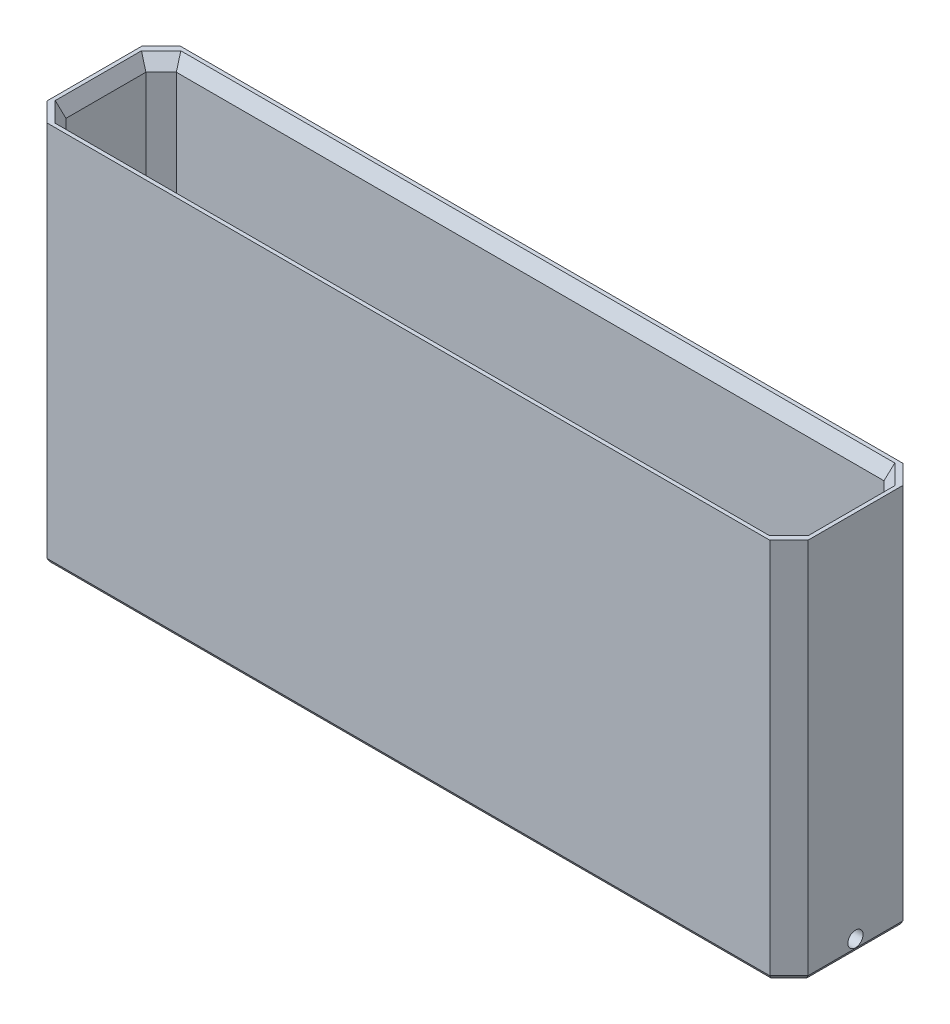
from build123d import *

# Parameters (mm, degrees)
SKETCH1_W           = 194
SKETCH1_H           = 29
BOSS_EXTRUDE1_DEPTH = 100
SKETCH1_3_W         = 194
SKETCH1_3_H         = 29
BOSS_EXTRUDE2_DEPTH = 3
CHAMFER1_SIZE       = 4
CHAMFER2_SIZE       = 5
CHAMFER3_SIZE       = 2
CHAMFER3_SIZE2      = 3.464101615
SKETCH2_R           = 2
CUT_EXTRUDE1_DEPTH  = 10
CHAMFER4_SIZE       = 0.5
CHAMFER4_SIZE2      = 0.866025404


with BuildPart() as part:
    # Sketch1 → Boss-Extrude1 (new body)
    with BuildSketch(Plane(origin=(0, 0, 0), x_dir=(1, 0, 0), z_dir=(0, 1, 0))):
        Polygon((-100, -17.5), (100, -17.5), (100, 17.5), (-97, 17.5), (-100, 17.5), (-100, 14.5), align=None)
        Rectangle(SKETCH1_W, SKETCH1_H, mode=Mode.SUBTRACT)
    extrude(amount=BOSS_EXTRUDE1_DEPTH)

    # Sketch1<3> → Boss-Extrude2 (add)
    with BuildSketch(Plane(origin=(0, 0, 0), x_dir=(1, 0, 0), z_dir=(0, 1, 0))):
        Rectangle(SKETCH1_3_W, SKETCH1_3_H)
    extrude(amount=BOSS_EXTRUDE2_DEPTH)

    # Chamfer1
    chamfer1_edges = [part.edges().sort_by_distance(p)[0] for p in [
        (0, 3, -14.5),
        (97, 51.5, -14.5),
        (97, 3, 0),
        (97, 51.5, 14.5),
        (0, 3, 14.5),
        (-97, 51.5, 14.5),
        (-97, 3, 0),
        (-97, 51.5, -14.5),
    ]]
    chamfer(chamfer1_edges, length=CHAMFER1_SIZE)

    # Chamfer2
    chamfer2_edges = [part.edges().sort_by_distance(p)[0] for p in [
        (100, 50, -17.5),
        (100, 50, 17.5),
        (-100, 50, 17.5),
        (-100, 50, -17.5),
    ]]
    chamfer(chamfer2_edges, length=CHAMFER2_SIZE)

    # Chamfer3
    chamfer3_edges = [part.edges().sort_by_distance(p)[0] for p in [
        (95, 100, 12.5),
        (97, 100, 0),
        (95, 100, -12.5),
        (0, 100, 14.5),
        (-95, 100, 12.5),
        (-97, 100, 0),
        (-95, 100, -12.5),
        (0, 100, -14.5),
    ]]
    chamfer3_side = [part.faces().sort_by_distance(p)[0] for p in [
        (0, 100, 15.46960595),
    ]]
    chamfer(chamfer3_edges, length=CHAMFER3_SIZE, length2=CHAMFER3_SIZE2, reference=chamfer3_side[0])

    # Sketch2 → Cut-Extrude1 (cut)
    with BuildSketch(Plane(origin=(100, 0, 0), x_dir=(0, 0, -1), z_dir=(1, 0, 0))):
        with Locations((0, 3)):
            Circle(SKETCH2_R)
    cut_extrude1 = extrude(amount=-CUT_EXTRUDE1_DEPTH, mode=Mode.SUBTRACT)

    # Mirror1: Cut-Extrude1 across plane
    add(cut_extrude1.mirror(Plane(origin=(0, 0, 0), x_dir=(0, 0, 1), z_dir=(1, 0, 0))), mode=Mode.SUBTRACT)

    # Chamfer4
    chamfer4_edges = [part.edges().sort_by_distance(p)[0] for p in [
        (-97.5, 0, -15),
        (-100, 0, 0),
        (-97.5, 0, 15),
        (0, 0, 17.5),
        (97.5, 0, 15),
        (100, 0, 0),
        (97.5, 0, -15),
        (0, 0, -17.5),
    ]]
    chamfer4_side = [part.faces().sort_by_distance(p)[0] for p in [
        (0, 0, 0),
    ]]
    chamfer(chamfer4_edges, length=CHAMFER4_SIZE, length2=CHAMFER4_SIZE2, reference=chamfer4_side[0])


solid = part.part
